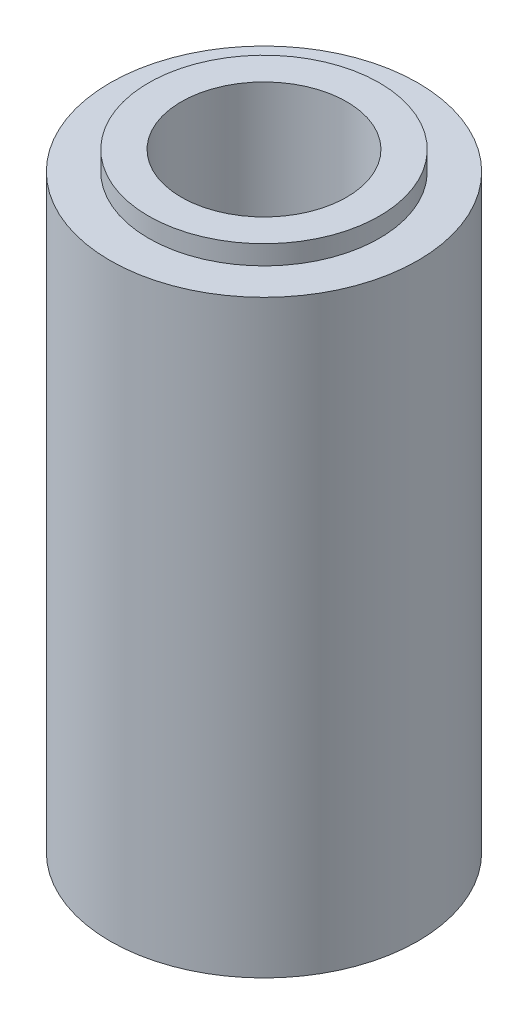
from build123d import *

# Parameters (mm, degrees)
SKETCH1_R            = 4
BOSS_EXTRUDE1_DEPTH  = 15.81880215
SKETCH2_OUTSIDE_W    = 13.89
SKETCH2_OUTSIDE_H    = 13.89
SKETCH2_OUTSIDE_R    = 3
CUT_EXTRUDE1_DEPTH   = 0.5
M4_CLEARANCE_HOLE1_D = 4.3


with BuildPart() as part:
    # Sketch1 → Boss-Extrude1 (new body)
    with BuildSketch(Plane(origin=(0, 0, 0), x_dir=(1, 0, 0), z_dir=(0, 1, 0))):
        Circle(SKETCH1_R)
    extrude(amount=BOSS_EXTRUDE1_DEPTH)

    # Sketch2 outside → Cut-Extrude1 (cut)
    with BuildSketch(Plane(origin=(0, 15.81880215, 0), x_dir=(1, 0, 0), z_dir=(0, 1, 0))):
        Rectangle(SKETCH2_OUTSIDE_W, SKETCH2_OUTSIDE_H)
        Circle(SKETCH2_OUTSIDE_R, mode=Mode.SUBTRACT)
    extrude(amount=-CUT_EXTRUDE1_DEPTH, mode=Mode.SUBTRACT)

    # M4 Clearance Hole1 (through all)
    with Locations(Plane(origin=(0, 15.81880215, 0), x_dir=(1, 0, 0), z_dir=(0, 1, 0))):
        with Locations((0, 0)):
            Hole(M4_CLEARANCE_HOLE1_D / 2)


solid = part.part
